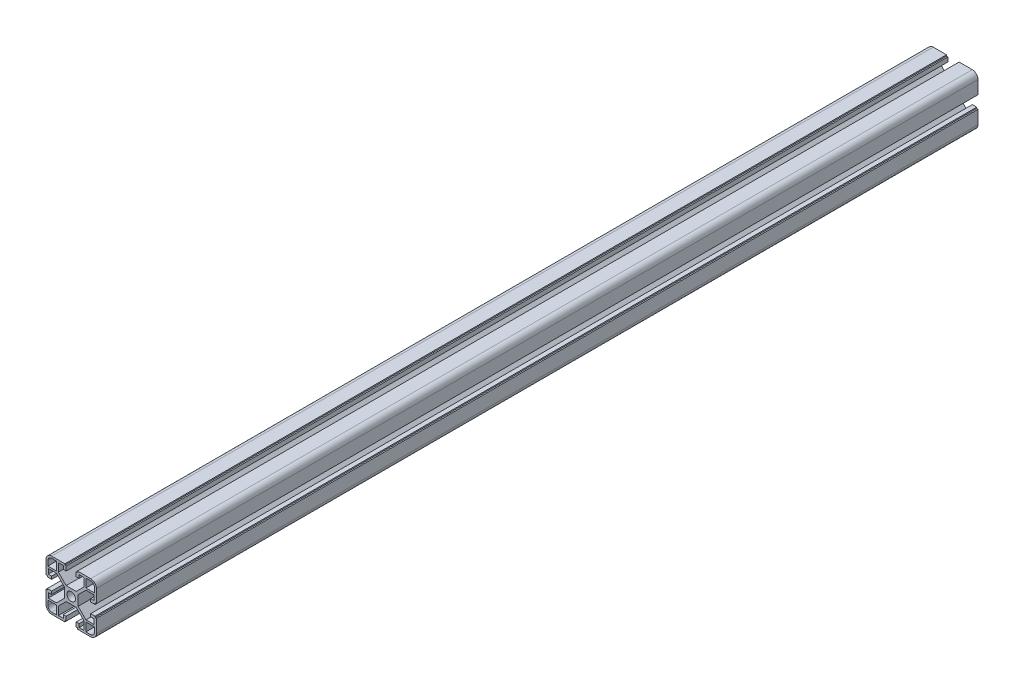
from build123d import *
from build123d.topology import SkipClean

# Parameters (mm, degrees)
BOSS_EXTRUDE1_DEPTH  = 700
MIRROR3_COPY_1_DEPTH = 700
MIRROR3_COPY_2_DEPTH = 700


with BuildPart() as part:
    # Sketch1 → Boss-Extrude1 (new body)
    with BuildSketch(Plane.XY):
        with BuildLine():
            Line((3.4, 0), (5.5, 0))
            Line((5.5, 0), (5.5, 4))
            Line((5.5, 4), (11.69, 10.19))
            Line((11.69, 10.19), (18.2, 10.19))
            Line((18.2, 10.19), (18.2, 6.3))
            Line((18.2, 6.3), (15.5, 6.3))
            Line((15.5, 6.3), (15.5, 4))
            Line((15.5, 4), (19, 4))
            Line((19, 4), (19, 5))
            Line((19, 5), (20, 5))
            Line((20, 5), (20, 15.5))
            ThreePointArc((20, 15.5), (18.681980515, 18.681980515), (15.5, 20))
            Line((15.5, 20), (5, 20))
            Line((5, 20), (5, 19))
            Line((5, 19), (4, 19))
            Line((4, 19), (4, 15.5))
            Line((4, 15.5), (6.3, 15.5))
            Line((6.3, 15.5), (6.3, 18.2))
            Line((6.3, 18.2), (10.19, 18.2))
            Line((10.19, 18.2), (10.19, 11.69))
            Line((10.19, 11.69), (4, 5.5))
            Line((4, 5.5), (0, 5.5))
            Line((0, 5.5), (0, 3.4))
            ThreePointArc((0, 3.4), (2.404163056, 2.404163056), (3.4, 0))
        make_face()
        with BuildLine():
            Line((18.5, 11.69), (18.5, 15.5))
            ThreePointArc((18.5, 15.5), (17.621320344, 17.621320344), (15.5, 18.5))
            Line((15.5, 18.5), (11.69, 18.5))
            Line((11.69, 18.5), (11.69, 11.69))
            Line((11.69, 11.69), (18.5, 11.69))
        make_face(mode=Mode.SUBTRACT)
    boss_extrude1 = extrude(amount=BOSS_EXTRUDE1_DEPTH)

    # Mirror1: Boss-Extrude1 across plane
    add(boss_extrude1.mirror(Plane.ZX))

    # Mirror2: Boss-Extrude1 across plane
    add(boss_extrude1.mirror(Plane(origin=(0, 0, 0), x_dir=(0, 0, 1), z_dir=(1, 0, 0))))

    # Mirror3 copy 1 sketch → Mirror3 copy 1 (add)
    with BuildSketch(Plane(origin=(0, 0, 0), x_dir=(-1, 0, 0), z_dir=(0, 0, 1))):
        with BuildLine():
            Line((3.4, 0), (5.5, 0))
            Line((5.5, 0), (5.5, 4))
            Line((5.5, 4), (11.69, 10.19))
            Line((11.69, 10.19), (18.2, 10.19))
            Line((18.2, 10.19), (18.2, 6.3))
            Line((18.2, 6.3), (15.5, 6.3))
            Line((15.5, 6.3), (15.5, 4))
            Line((15.5, 4), (19, 4))
            Line((19, 4), (19, 5))
            Line((19, 5), (20, 5))
            Line((20, 5), (20, 15.5))
            ThreePointArc((20, 15.5), (18.681980515, 18.681980515), (15.5, 20))
            Line((15.5, 20), (5, 20))
            Line((5, 20), (5, 19))
            Line((5, 19), (4, 19))
            Line((4, 19), (4, 15.5))
            Line((4, 15.5), (6.3, 15.5))
            Line((6.3, 15.5), (6.3, 18.2))
            Line((6.3, 18.2), (10.19, 18.2))
            Line((10.19, 18.2), (10.19, 11.69))
            Line((10.19, 11.69), (4, 5.5))
            Line((4, 5.5), (0, 5.5))
            Line((0, 5.5), (0, 3.4))
            ThreePointArc((0, 3.4), (2.404163056, 2.404163056), (3.4, 0))
        make_face()
        with BuildLine():
            Line((18.5, 11.69), (18.5, 15.5))
            ThreePointArc((18.5, 15.5), (17.621320344, 17.621320344), (15.5, 18.5))
            Line((15.5, 18.5), (11.69, 18.5))
            Line((11.69, 18.5), (11.69, 11.69))
            Line((11.69, 11.69), (18.5, 11.69))
        make_face(mode=Mode.SUBTRACT)
    extrude(amount=MIRROR3_COPY_1_DEPTH)

    # Mirror3 copy 2 sketch → Mirror3 copy 2 (add)
    with SkipClean():  # the faces are left unmerged after this step: merging them gives an invalid solid
        with BuildSketch(Plane.XY):
            with BuildLine():
                Line((3.4, 0), (5.5, 0))
                Line((5.5, 0), (5.5, -4))
                Line((5.5, -4), (11.69, -10.19))
                Line((11.69, -10.19), (18.2, -10.19))
                Line((18.2, -10.19), (18.2, -6.3))
                Line((18.2, -6.3), (15.5, -6.3))
                Line((15.5, -6.3), (15.5, -4))
                Line((15.5, -4), (19, -4))
                Line((19, -4), (19, -5))
                Line((19, -5), (20, -5))
                Line((20, -5), (20, -15.5))
                ThreePointArc((20, -15.5), (18.681980515, -18.681980515), (15.5, -20))
                Line((15.5, -20), (5, -20))
                Line((5, -20), (5, -19))
                Line((5, -19), (4, -19))
                Line((4, -19), (4, -15.5))
                Line((4, -15.5), (6.3, -15.5))
                Line((6.3, -15.5), (6.3, -18.2))
                Line((6.3, -18.2), (10.19, -18.2))
                Line((10.19, -18.2), (10.19, -11.69))
                Line((10.19, -11.69), (4, -5.5))
                Line((4, -5.5), (0, -5.5))
                Line((0, -5.5), (0, -3.4))
                ThreePointArc((0, -3.4), (2.404163056, -2.404163056), (3.4, 0))
            make_face()
            with BuildLine():
                Line((18.5, -11.69), (18.5, -15.5))
                ThreePointArc((18.5, -15.5), (17.621320344, -17.621320344), (15.5, -18.5))
                Line((15.5, -18.5), (11.69, -18.5))
                Line((11.69, -18.5), (11.69, -11.69))
                Line((11.69, -11.69), (18.5, -11.69))
            make_face(mode=Mode.SUBTRACT)
        extrude(amount=MIRROR3_COPY_2_DEPTH)


solid = part.part
